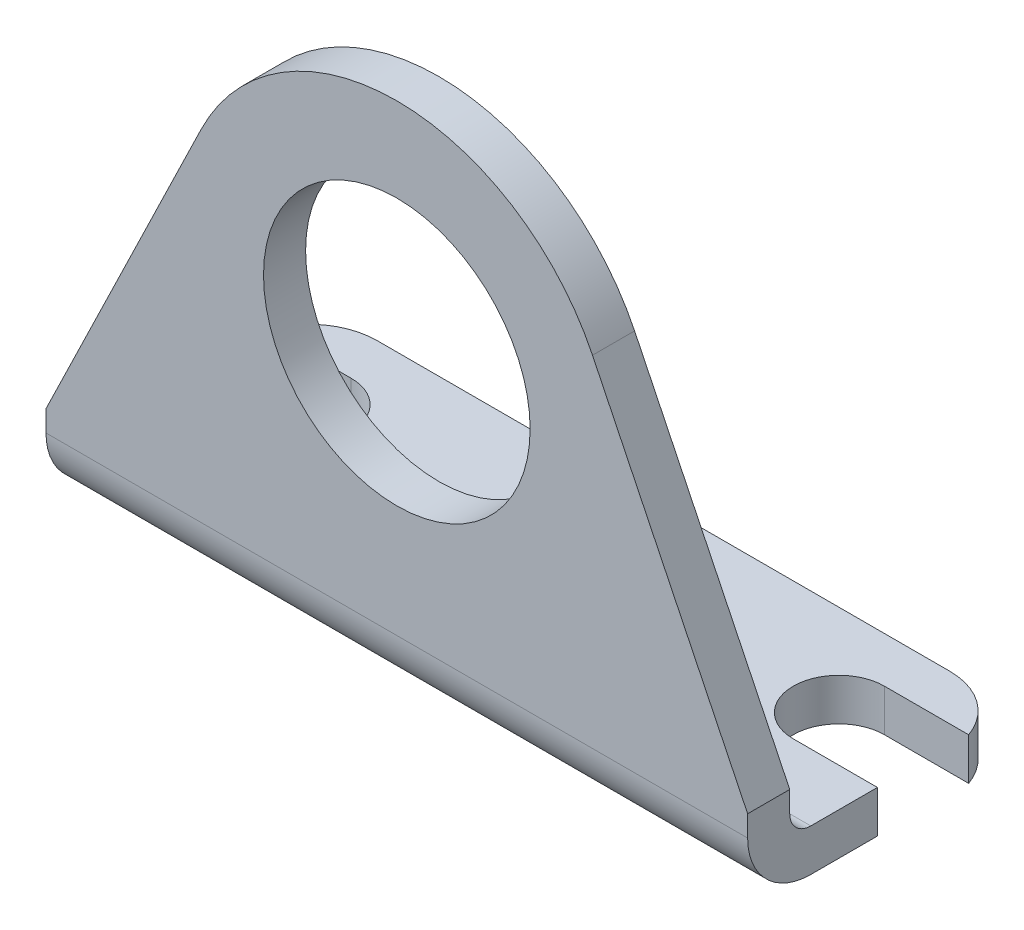
from build123d import *

# Parameters (mm, degrees)
BOSS_EXTRUDE1_DEPTH      = 6.35
BOSS_EXTRUDE1_DEPTH_BACK = 3.302
SKETCH3_R                = 4.826
CUT_EXTRUDE1_DEPTH       = 24.759524406
CUT_EXTRUDE2_DEPTH       = 33.378773911
FILLET1_R                = 2.4765


with BuildPart() as part:
    # Sketch3 → Boss-Extrude1 (new, two sides: drawn at the far end of the back side and taken through both)
    with BuildSketch(Plane.XY.offset(-BOSS_EXTRUDE1_DEPTH_BACK)):
        with BuildLine():
            Line((-12.7, 0), (12.7, 0))
            Line((12.7, 0), (12.7, 3.048))
            Line((12.7, 3.048), (7.083102209, 14.615409702))
            ThreePointArc((7.083102209, 14.615409702), (0, 19.05), (-7.083102209, 14.615409702))
            Line((-7.083102209, 14.615409702), (-12.7, 3.048))
            Line((-12.7, 3.048), (-12.7, 0))
        make_face()
        with Locations((0, 11.176)):
            Circle(SKETCH3_R, mode=Mode.SUBTRACT)
    extrude(amount=BOSS_EXTRUDE1_DEPTH + BOSS_EXTRUDE1_DEPTH_BACK)

    # Sketch4 → Cut-Extrude1 (cut, through all)
    with BuildSketch(Plane(origin=(0, 0, 0), x_dir=(1, 0, 0), z_dir=(0, 1, 0))):
        with BuildLine():
            Line((-12.7, 1.651), (-12.7, -1.651))
            Line((-12.7, -1.651), (-9.652, -1.651))
            ThreePointArc((-9.652, -1.651), (-8.001, 0), (-9.652, 1.651))
            Line((-9.652, 1.651), (-12.7, 1.651))
        make_face()
        with BuildLine():
            Line((9.652, 1.651), (12.7, 1.651))
            Line((12.7, 1.651), (12.7, -1.651))
            Line((12.7, -1.651), (9.652, -1.651))
            ThreePointArc((9.652, -1.651), (8.001, 0), (9.652, 1.651))
        make_face()
    extrude(amount=CUT_EXTRUDE1_DEPTH, mode=Mode.SUBTRACT)

    # Sketch5 → Cut-Extrude2 (cut, through all)
    with BuildSketch(Plane.ZY.offset(12.7)):
        with BuildLine():
            Line((-3.302, 19.05), (4.826, 19.05))
            Line((4.826, 19.05), (4.826, 2.286))
            ThreePointArc((4.826, 2.286), (4.602815367, 1.747184633), (4.064, 1.524))
            Line((4.064, 1.524), (-3.302, 1.524))
            Line((-3.302, 1.524), (-3.302, 19.05))
        make_face()
        with BuildLine():
            Line((4.064, 0), (6.35, 0))
            Line((6.35, 0), (6.35, 2.286))
            ThreePointArc((6.35, 2.286), (5.680446102, 0.669553898), (4.064, 0))
        make_face()
    extrude(amount=-CUT_EXTRUDE2_DEPTH, mode=Mode.SUBTRACT)

    # Fillet1
    # the kernel refuses this fillet: 2.4765 mm, written as the material it takes off along each edge
    with BuildSketch(Plane(origin=(-12.7, 7.361166479, -3.302), x_dir=(1, 0, 0), z_dir=(0, -1, 0))) as fillet1_piece_1:
        with BuildLine():
            CenterArc((2.334866591, 2.4765), FILLET1_R, 199.471220634, 70.528779366)
            Line((0, 1.651), (-0.046697332, 1.63449))
            ThreePointArc((-0.046697332, 1.63449), (-0.04953, 0.8255), (-0.04953, 0))
            Line((-0.04953, 0), (0, -0.04953))
            Line((0, -0.04953), (2.334866591, -0.04953))
            Line((2.334866591, -0.04953), (2.334866591, 0))
        make_face()
    extrude(amount=13.198332957, mode=Mode.SUBTRACT)
    with BuildSketch(Plane(origin=(12.7, -5.837166479, -3.302), x_dir=(0, 0, 1), z_dir=(0, 1, 0))) as fillet1_piece_2:
        with BuildLine():
            CenterArc((2.4765, -2.334866591), FILLET1_R, 109.471220634, 70.528779366)
            Line((0, -2.334866591), (-0.04953, -2.334866591))
            Line((-0.04953, -2.334866591), (-0.04953, 0))
            Line((-0.04953, 0), (0, 0.04953))
            ThreePointArc((0, 0.04953), (0.8255, 0.04953), (1.63449, 0.046697332))
            Line((1.63449, 0.046697332), (1.651, 0))
        make_face()
    extrude(amount=13.198332957, mode=Mode.SUBTRACT)


solid = part.part
